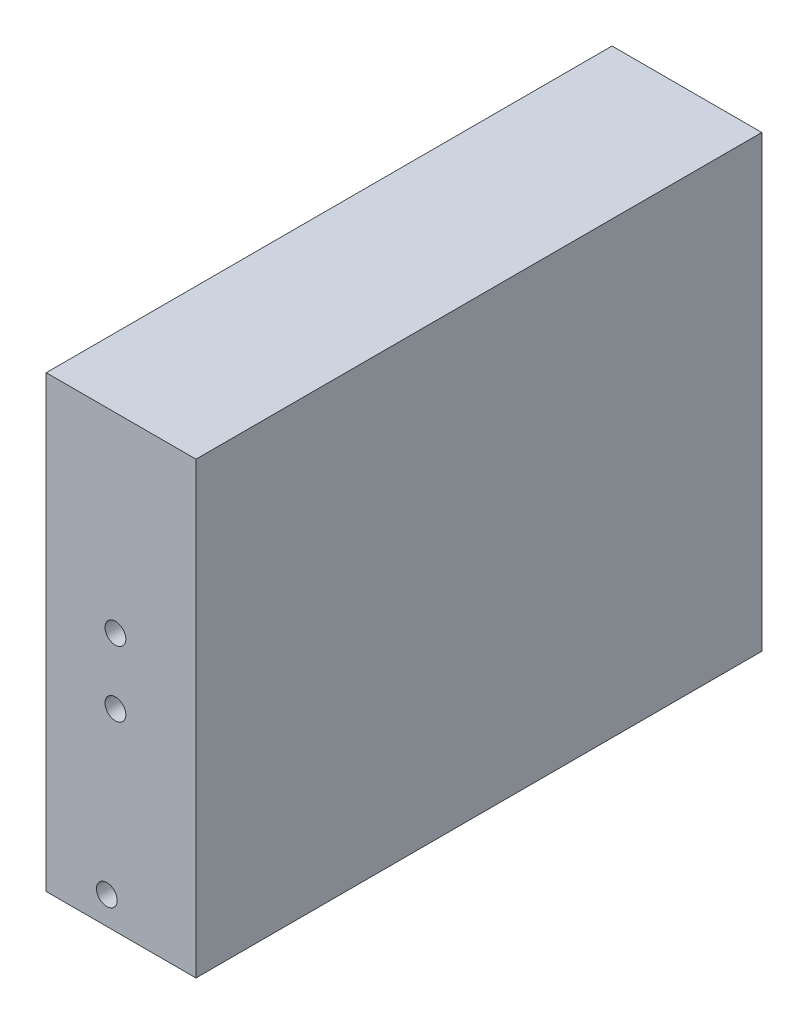
from build123d import *

# Parameters (mm, degrees)
SKETCH1_W           = 57.15
SKETCH1_H           = 171.45
BOSS_EXTRUDE1_DEPTH = 215.9
SKETCH2_R           = 3.175
CUT_EXTRUDE1_DEPTH  = 46.7399878
SKETCH3_R           = 3.96875
CUT_EXTRUDE2_DEPTH  = 13.0400044
SKETCH4_R           = 3.175
CUT_EXTRUDE3_DEPTH  = 35.1600008
SKETCH5_R           = 3.175
CUT_EXTRUDE4_DEPTH  = 94.6600088
SKETCH6_R           = 3.96875
CUT_EXTRUDE5_DEPTH  = 10.16
SKETCH7_R           = 3.96875
CUT_EXTRUDE6_DEPTH  = 69.660008


with BuildPart() as part:
    # Sketch1 → Boss-Extrude1 (new body)
    with BuildSketch(Plane.XY):
        with Locations((28.575, 85.725)):
            Rectangle(SKETCH1_W, SKETCH1_H)
    extrude(amount=BOSS_EXTRUDE1_DEPTH)

    # Sketch2 → Cut-Extrude1 (cut)
    with BuildSketch(Plane(origin=(0, 0, 0), x_dir=(-1, 0, 0), z_dir=(0, 0, -1))):
        with Locations((-24.41, 70.569)):
            Circle(SKETCH2_R)
    extrude(amount=-CUT_EXTRUDE1_DEPTH, mode=Mode.SUBTRACT)

    # Sketch3 → Cut-Extrude2 (cut)
    with BuildSketch(Plane(origin=(0, 0, 0), x_dir=(-1, 0, 0), z_dir=(0, 0, -1))):
        with Locations((-24.41, 70.569)):
            Circle(SKETCH3_R)
    extrude(amount=-CUT_EXTRUDE2_DEPTH, mode=Mode.SUBTRACT)

    # Sketch4 → Cut-Extrude3 (cut)
    with BuildSketch(Plane.XY.offset(215.9)):
        with Locations((26.41, 73.569)):
            Circle(SKETCH4_R)
        with Locations((26.41, 98.569)):
            Circle(SKETCH4_R)
    extrude(amount=-CUT_EXTRUDE3_DEPTH, mode=Mode.SUBTRACT)

    # Sketch5 → Cut-Extrude4 (cut)
    with BuildSketch(Plane.XY.offset(215.9)):
        with Locations((23.13, 10.569)):
            Circle(SKETCH5_R)
    extrude(amount=-CUT_EXTRUDE4_DEPTH, mode=Mode.SUBTRACT)

    # Sketch6 → Cut-Extrude5 (cut)
    with BuildSketch(Plane.XY.offset(215.9)):
        with Locations((26.41, 73.569)):
            Circle(SKETCH6_R)
        with Locations((26.41, 98.569)):
            Circle(SKETCH6_R)
    extrude(amount=-CUT_EXTRUDE5_DEPTH, mode=Mode.SUBTRACT)

    # Sketch7 → Cut-Extrude6 (cut)
    with BuildSketch(Plane.XY.offset(215.9)):
        with Locations((23.13, 10.569)):
            Circle(SKETCH7_R)
    extrude(amount=-CUT_EXTRUDE6_DEPTH, mode=Mode.SUBTRACT)


solid = part.part
